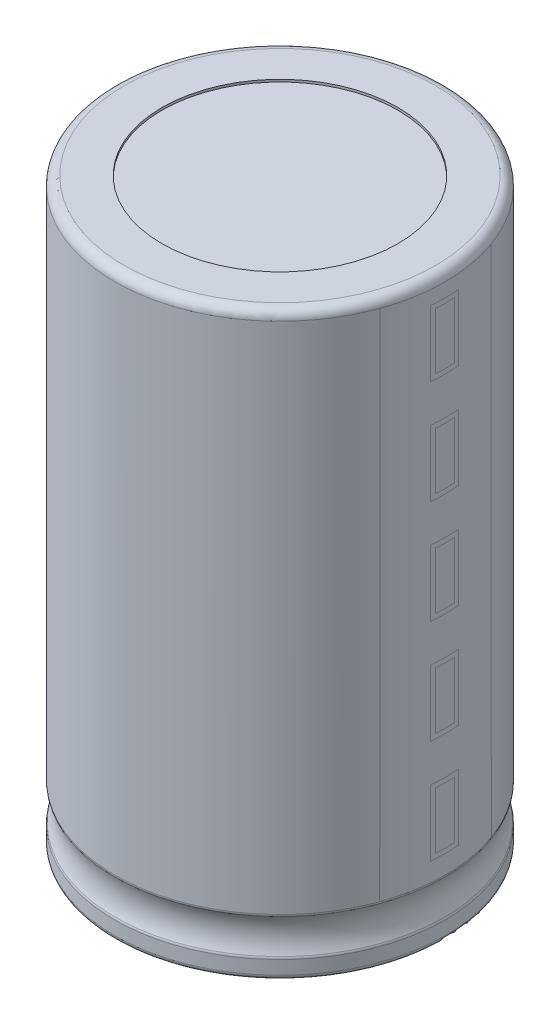
from build123d import *

# Parameters (mm, degrees)
SKETCH_5_W      = 1.6
SKETCH_5_H      = 0.8
EXTRUDE_1_DEPTH = 6
FILLET_1_R      = 0.25
CHAMFER_1_SIZE  = 0.25


with BuildPart() as part:
    # Эскиз1 → Повернуть1 (revolve)
    with BuildSketch(Plane(origin=(0, 0, 0), x_dir=(0, 0, -1), z_dir=(1, 0, 0))):
        with BuildLine():
            Line((12.5, 0), (17, 0))
            ThreePointArc((17, 0), (17.353553391, 0.146446609), (17.5, 0.5))
            Line((17.5, 0.5), (17.5, 1.938447187))
            ThreePointArc((17.5, 1.938447187), (17.485912658, 2.056298317), (17.444444444, 2.167508611))
            ThreePointArc((17.444444444, 2.167508611), (17, 4), (17.444444444, 5.832491389))
            ThreePointArc((17.444444444, 5.832491389), (17.485912658, 5.943701683), (17.5, 6.061552813))
            Line((17.5, 6.061552813), (17.5, 60.5))
            ThreePointArc((17.5, 60.5), (17.207106781, 61.207106781), (16.5, 61.5))
            Line((16.5, 61.5), (12.5, 61.5))
            Line((12.5, 61.5), (12.5, 61.25))
            Line((12.5, 61.25), (0, 61.25))
            Line((0, 61.25), (0, 1))
            Line((0, 1), (14, 1))
            Line((14, 1), (14, 0.25))
            Line((14, 0.25), (12.5, 0.25))
            Line((12.5, 0.25), (12.5, 0))
        make_face()
    revolve(axis=Axis((0, -15.50581722, 0), (0, 1, 0)))

    # Эскиз5 → Бобышка-Вытянуть1 (add)
    with BuildSketch(Plane.XZ.offset(-1)):
        with Locations((-5, 0)):
            Rectangle(SKETCH_5_W, SKETCH_5_H)
        with Locations((5, 0)):
            Rectangle(SKETCH_5_W, SKETCH_5_H)
    extrude(amount=EXTRUDE_1_DEPTH)

    # Скругление1
    fillet_1_edges = [part.edges().sort_by_distance(p)[0] for p in [
        (4.2, -2, 0.4),
        (-4.2, -2, 0.4),
        (-4.2, -2, -0.4),
        (5.8, -2, 0.4),
        (5.8, -2, -0.4),
        (4.2, -2, -0.4),
        (-5.8, -2, -0.4),
        (-5.8, -2, 0.4),
    ]]
    fillet(fillet_1_edges, radius=FILLET_1_R)

    # Фаска1
    chamfer_1_edges = [part.edges().sort_by_distance(p)[0] for p in [
        (-4.273223305, -5, -0.326776695),
        (-5, -5, -0.4),
        (-5.726776695, -5, -0.326776695),
        (-5.8, -5, 0),
        (-5.726776695, -5, 0.326776695),
        (-5, -5, 0.4),
        (-4.273223305, -5, 0.326776695),
        (-4.2, -5, 0),
        (5.726776695, -5, 0.326776695),
        (5.8, -5, 0),
        (5.726776695, -5, -0.326776695),
        (5, -5, -0.4),
        (4.273223305, -5, -0.326776695),
        (4.2, -5, 0),
        (4.273223305, -5, 0.326776695),
        (5, -5, 0.4),
    ]]
    chamfer(chamfer_1_edges, length=CHAMFER_1_SIZE)


solid = part.part
